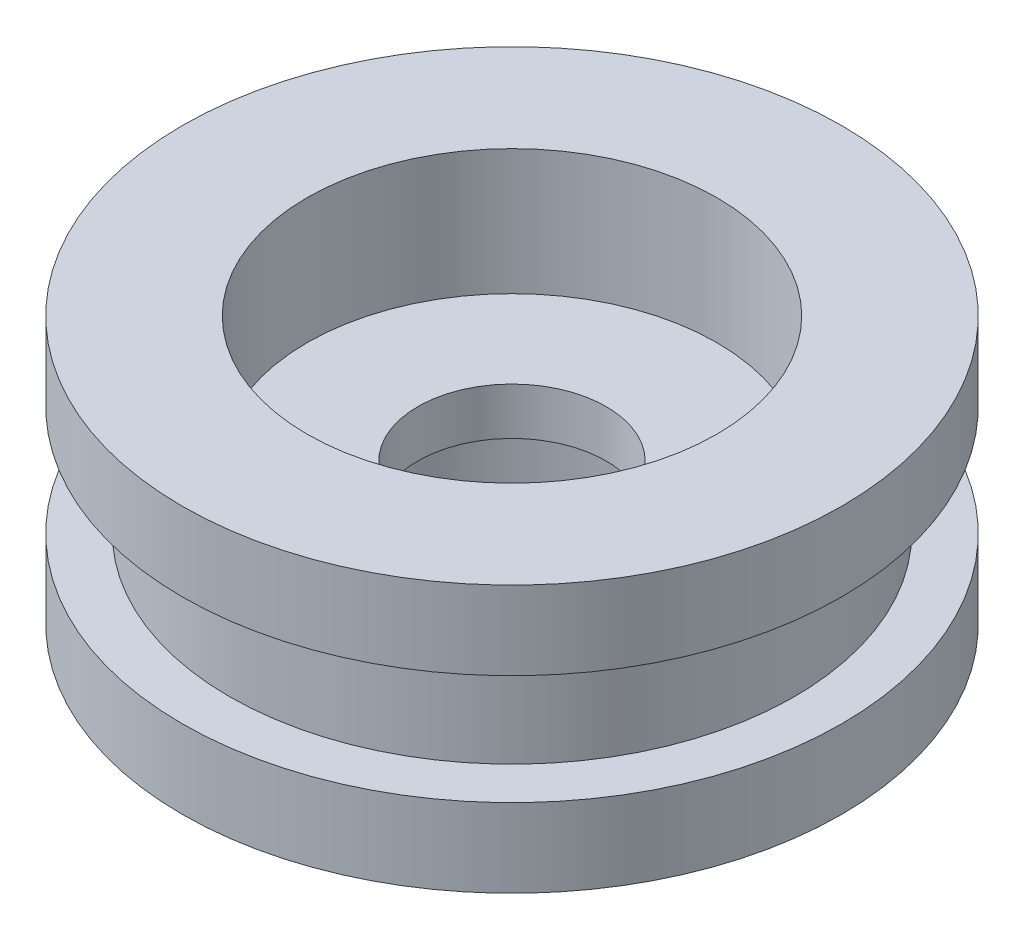
from build123d import *


with BuildPart() as part:
    # Sketch2 → Revolve1 (revolve)
    with BuildSketch(Plane.XY):
        Polygon((6, 1.5), (13.05, 1.5), (13.05, 9.5), (21, 9.5), (21, 4.5), (18, 4.5), (18, -2.5), (21, -2.5), (21, -7.5), (18, -7.5), (18, -9.5), (13.05, -9.5), (13.05, -1.5), (6, -1.5), align=None)
    revolve(axis=Axis((0, 17.262135922, 0), (0, -1, 0)))


solid = part.part
